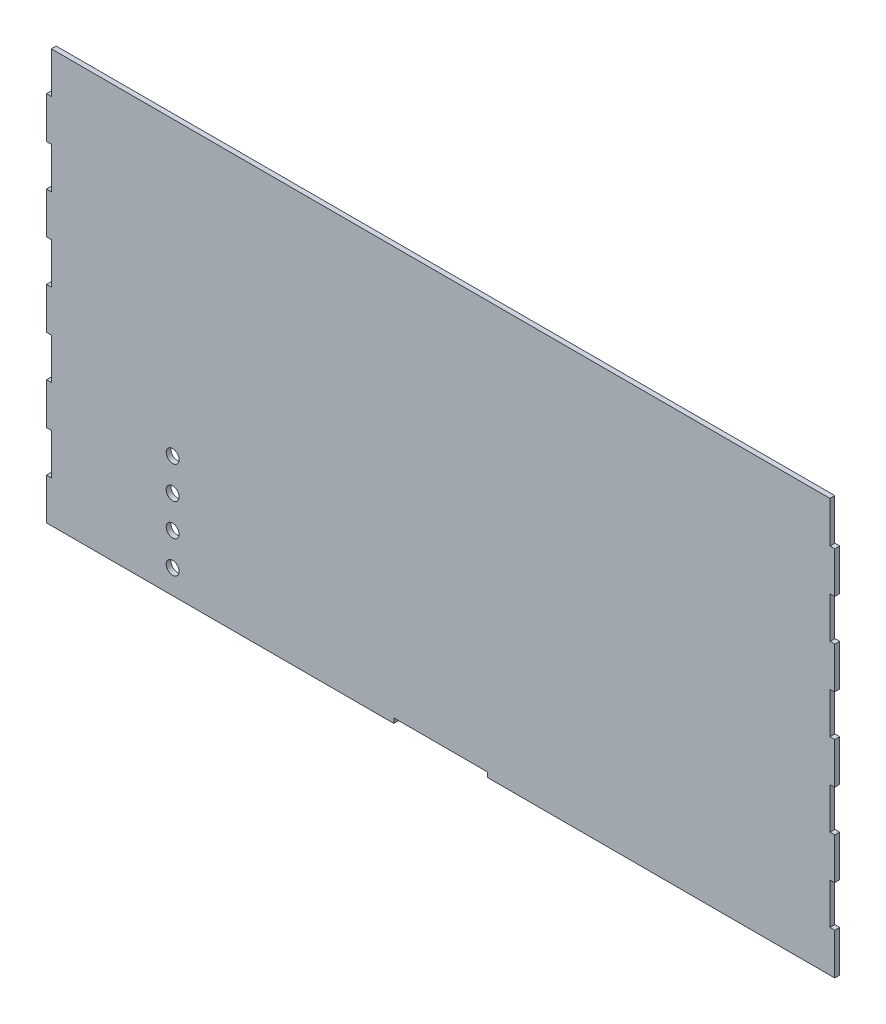
from build123d import *

# Parameters (mm, degrees)
SKETCH1_W           = 977.375
SKETCH1_H           = 512
BOSS_EXTRUDE1_DEPTH = 6
CUT_EXTRUDE3_DEPTH  = 10
LPATTERN1_COUNT     = 5
LPATTERN1_PITCH     = 102.4
SKETCH8_W           = 6
SKETCH8_H           = 0.580661117
CUT_EXTRUDE4_DEPTH  = 10
CUT_EXTRUDE5_DEPTH  = 10
LPATTERN4_COUNT     = 5
LPATTERN4_PITCH     = 102.4
SKETCH11_W          = 6
SKETCH11_H          = 0.733192148
CUT_EXTRUDE6_DEPTH  = 10
SKETCH14_W          = 116
SKETCH14_H          = 6
CUT_EXTRUDE9_DEPTH  = 10
SKETCH15_R          = 8
CUT_EXTRUDE11_DEPTH = 10
LPATTERN5_COUNT     = 4
LPATTERN5_PITCH     = 40


with BuildPart() as part:
    # Sketch1 → Boss-Extrude1 (new body)
    with BuildSketch(Plane.XY):
        Rectangle(SKETCH1_W, SKETCH1_H)
    extrude(amount=BOSS_EXTRUDE1_DEPTH)

    # Sketch7 → Cut-Extrude3 (cut)
    with BuildSketch(Plane.XY.offset(6)):
        with BuildLine():
            add(Edge.make_bspline(
                [(488.6875, -204.8), (488.6875, -204.6), (485.6875, -204.6), (482.6875, -204.6), (482.6875, -204.8)],
                knots=[0, 0, 0, 1.570796327, 1.570796327, 3.141592654, 3.141592654, 3.141592654], degree=2, weights=[1, 0.707106781, 1, 0.707106781, 1]))
            Line((488.6875, -204.8), (488.6875, -153.6))
            add(Edge.make_bspline(
                [(482.6875, -153.6), (482.6875, -153.8), (485.6875, -153.8), (488.6875, -153.8), (488.6875, -153.6)],
                knots=[3.141592654, 3.141592654, 3.141592654, 4.71238898, 4.71238898, 6.283185307, 6.283185307, 6.283185307], degree=2, weights=[1, 0.707106781, 1, 0.707106781, 1]))
            Line((482.6875, -153.6), (482.6875, -204.8))
        make_face()
    cut_extrude3 = extrude(amount=-CUT_EXTRUDE3_DEPTH, mode=Mode.SUBTRACT)

    # LPattern1: Cut-Extrude3 ×5
    with Locations(*[(0, i * LPATTERN1_PITCH, 0) for i in range(1, LPATTERN1_COUNT)]):
        add(cut_extrude3, mode=Mode.SUBTRACT)

    # Sketch8 → Cut-Extrude4 (cut)
    with BuildSketch(Plane.XY.offset(6)):
        with Locations((485.6875, 255.709669442)):
            Rectangle(SKETCH8_W, SKETCH8_H)
    extrude(amount=-CUT_EXTRUDE4_DEPTH, mode=Mode.SUBTRACT)

    # Sketch10 → Cut-Extrude5 (cut)
    with BuildSketch(Plane.XY.offset(6)):
        with BuildLine():
            Line((-488.6875, -153.6), (-488.6875, -204.8))
            add(Edge.make_bspline(
                [(-482.6875, -204.8), (-482.6875, -204.6), (-485.6875, -204.6), (-488.6875, -204.6), (-488.6875, -204.8)],
                knots=[0, 0, 0, 1.570796327, 1.570796327, 3.141592654, 3.141592654, 3.141592654], degree=2, weights=[1, 0.707106781, 1, 0.707106781, 1]))
            Line((-482.6875, -204.8), (-482.6875, -153.6))
            add(Edge.make_bspline(
                [(-488.6875, -153.6), (-488.6875, -153.8), (-485.6875, -153.8), (-482.6875, -153.8), (-482.6875, -153.6)],
                knots=[3.141592654, 3.141592654, 3.141592654, 4.71238898, 4.71238898, 6.283185307, 6.283185307, 6.283185307], degree=2, weights=[1, 0.707106781, 1, 0.707106781, 1]))
        make_face()
    cut_extrude5 = extrude(amount=-CUT_EXTRUDE5_DEPTH, mode=Mode.SUBTRACT)

    # LPattern4: Cut-Extrude5 ×5
    with Locations(*[(0, i * LPATTERN4_PITCH, 0) for i in range(1, LPATTERN4_COUNT)]):
        add(cut_extrude5, mode=Mode.SUBTRACT)

    # Sketch11 → Cut-Extrude6 (cut)
    with BuildSketch(Plane.XY.offset(6)):
        with Locations((-485.6875, 255.633403926)):
            Rectangle(SKETCH11_W, SKETCH11_H)
    extrude(amount=-CUT_EXTRUDE6_DEPTH, mode=Mode.SUBTRACT)

    # Sketch14 → Cut-Extrude9 (cut)
    with BuildSketch(Plane.XY.offset(6)):
        with Locations((0, -253.030374654)):
            Rectangle(SKETCH14_W, SKETCH14_H)
    extrude(amount=-CUT_EXTRUDE9_DEPTH, mode=Mode.SUBTRACT)

    # Sketch15 → Cut-Extrude11 (cut)
    with BuildSketch(Plane.XY.offset(6)):
        with Locations((-332.1875, -226)):
            Circle(SKETCH15_R)
    cut_extrude11 = extrude(amount=-CUT_EXTRUDE11_DEPTH, mode=Mode.SUBTRACT)

    # LPattern5: Cut-Extrude11 ×4
    with Locations(*[(0, i * LPATTERN5_PITCH, 0) for i in range(1, LPATTERN5_COUNT)]):
        add(cut_extrude11, mode=Mode.SUBTRACT)


solid = part.part
